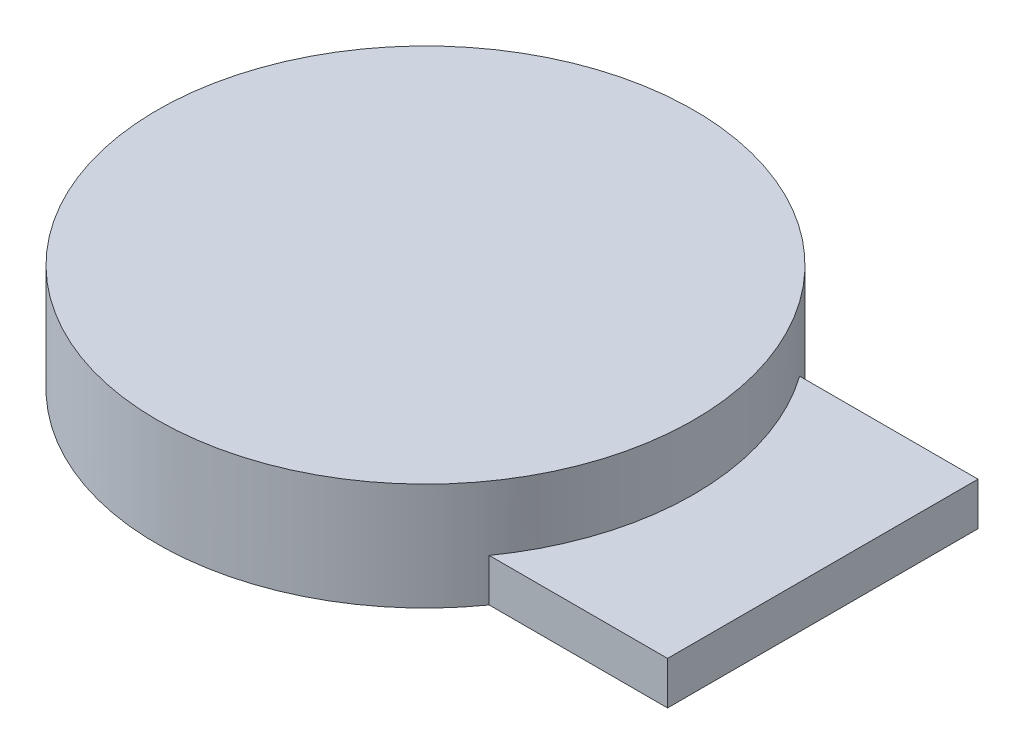
from build123d import *

# Parameters (mm, degrees)
SKETCH1_R           = 15.875
BOSS_EXTRUDE1_DEPTH = 6.35
SKETCH2_W           = 15.252884162
SKETCH2_H           = 18.365256134
BOSS_EXTRUDE2_DEPTH = 2.54


with BuildPart() as part:
    # Sketch1 → Boss-Extrude1 (new body)
    with BuildSketch(Plane(origin=(0, 0, 0), x_dir=(1, 0, 0), z_dir=(0, 1, 0))):
        Circle(SKETCH1_R)
    extrude(amount=BOSS_EXTRUDE1_DEPTH)

    # Sketch2 → Boss-Extrude2 (add)
    with BuildSketch(Plane.XZ):
        with Locations((15.875, 0)):
            Rectangle(SKETCH2_W, SKETCH2_H)
    extrude(amount=-BOSS_EXTRUDE2_DEPTH)


solid = part.part
